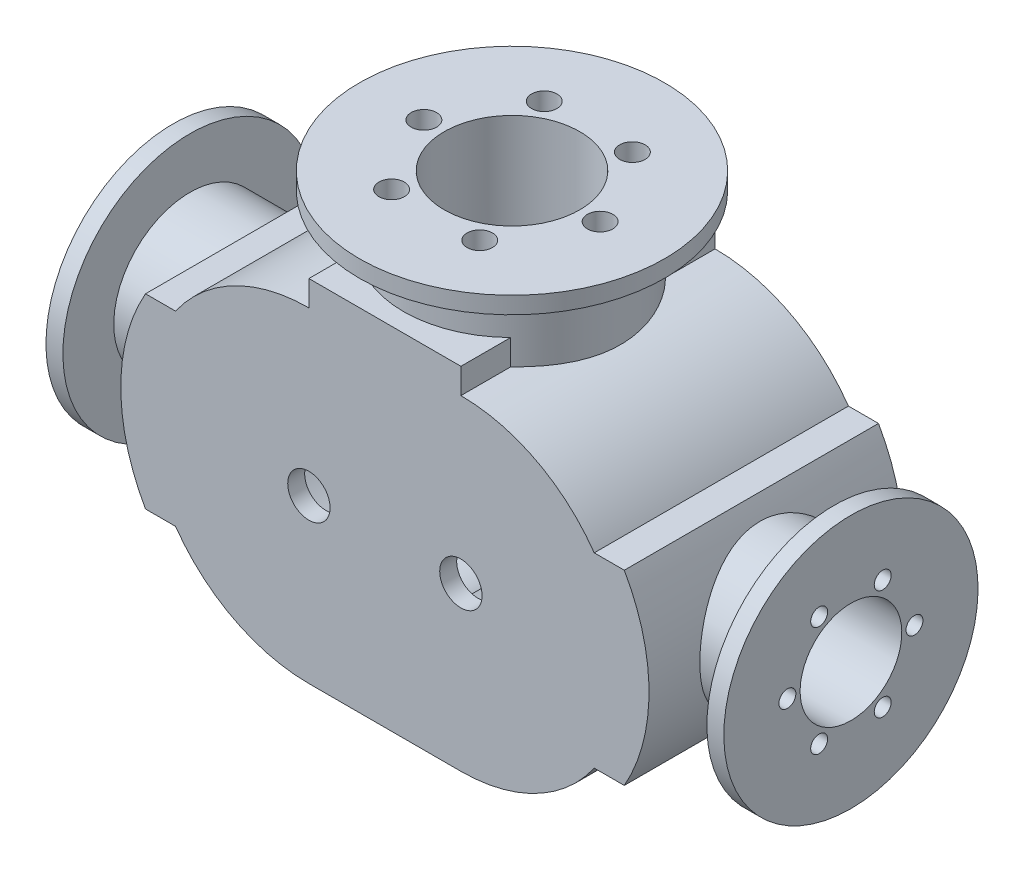
from build123d import *
from build123d.topology import SkipClean

# Parameters (mm, degrees)
BOSS_EXTRUDE1_DEPTH      = 150
CUT_EXTRUDE1_DEPTH       = 140
SKETCH5_R                = 12.5
CUT_EXTRUDE2_DEPTH       = 140
SKETCH6_W                = 89.69
SKETCH6_H                = 15
BOSS_EXTRUDE2_DEPTH      = 150
SKETCH20_R               = 5
CUT_EXTRUDE5_DEPTH       = 30
CRVPATTERN1_OUTLINE_R    = 5
CRVPATTERN1_DEPTH        = 30
BOSS_EXTRUDE3_START      = -16.9304
SKETCH22_R               = 64
SKETCH22_R_2             = 40
BOSS_EXTRUDE3_DEPTH      = 46.9304
CUT_EXTRUDE6_REACH       = 327.001
SKETCH27_R               = 90
SKETCH27_R_2             = 40
BOSS_EXTRUDE4_DEPTH      = 10
SKETCH29_R               = 7.5
CUT_EXTRUDE7_DEPTH       = 40
CIRPATTERN1_COUNT        = 6
BOSS_EXTRUDE5_REACH      = 422.299
BOSS_EXTRUDE5_END_RADIUS = 111
BOSS_EXTRUDE6_DEPTH      = 10
CUT_EXTRUDE8_DEPTH       = 421.299493249
SKETCH37_R               = 5
CUT_EXTRUDE9_DEPTH       = 30
CIRPATTERN2_COUNT        = 6
MIRROR2_COPY_1_SKETCH_R  = 5
MIRROR2_COPY_1_DEPTH     = 30
MIRROR2_COPY_2_SKETCH_R  = 5
MIRROR2_COPY_2_DEPTH     = 30
MIRROR2_COPY_3_SKETCH_R  = 5
MIRROR2_COPY_3_DEPTH     = 30
MIRROR2_COPY_4_SKETCH_R  = 5
MIRROR2_COPY_4_DEPTH     = 30
MIRROR2_COPY_5_SKETCH_R  = 5
MIRROR2_COPY_5_DEPTH     = 30


# Read off the part's stored shape, not the designer's step: CrvPattern1
with BuildPart() as part:
    # Sketch1 → Boss-Extrude1 (new body)
    with BuildSketch(Plane.XY):
        with BuildLine():
            Line((0, 96), (89.69, 96))
            ThreePointArc((89.69, 96), (185.69, 0), (89.69, -96))
            Line((89.69, -96), (0, -96))
            ThreePointArc((0, -96), (-96, 0), (0, 96))
        make_face()
    extrude(amount=BOSS_EXTRUDE1_DEPTH)

    # Sketch4 → Cut-Extrude1 (cut)
    with BuildSketch(Plane(origin=(0, 0, 0), x_dir=(-1, 0, 0), z_dir=(0, 0, -1))):
        with BuildLine():
            ThreePointArc((-44.845, 53.422733691), (-159.44, 0), (-44.845, -53.422733691))
            ThreePointArc((-44.845, -53.422733691), (69.75, 0), (-44.845, 53.422733691))
        make_face()
    extrude(amount=-CUT_EXTRUDE1_DEPTH, mode=Mode.SUBTRACT)

    # Sketch5 → Cut-Extrude2 (cut)
    with BuildSketch(Plane(origin=(0, 0, 140), x_dir=(-1, 0, 0), z_dir=(0, 0, -1))):
        with Locations((-89.69, 0)):
            Circle(SKETCH5_R)
        Circle(SKETCH5_R)
    extrude(amount=-CUT_EXTRUDE2_DEPTH, mode=Mode.SUBTRACT)

    # Sketch6 → Boss-Extrude2 (add, through all)
    with BuildSketch(Plane(origin=(0, 0, 0), x_dir=(-1, 0, 0), z_dir=(0, 0, -1))):
        with Locations((-44.845, 103.5)):
            Rectangle(SKETCH6_W, SKETCH6_H)
        with BuildLine():
            Line((-168.372907928, 55), (-186.105766346, 55))
            ThreePointArc((-186.105766346, 55), (-200.69, 0), (-186.105766346, -55))
            Line((-186.105766346, -55), (-168.372907928, -55))
            ThreePointArc((-168.372907928, -55), (-185.69, 0), (-168.372907928, 55))
        make_face()
        with BuildLine():
            ThreePointArc((96.415766346, -55), (111, 0), (96.415766346, 55))
            Line((96.415766346, 55), (78.682907928, 55))
            ThreePointArc((78.682907928, 55), (96, 0), (78.682907928, -55))
            Line((78.682907928, -55), (96.415766346, -55))
        make_face()
    extrude(amount=-BOSS_EXTRUDE2_DEPTH)

    # Sketch20 → Cut-Extrude5 (cut)
    with BuildSketch(Plane(origin=(0, 0, 0), x_dir=(-1, 0, 0), z_dir=(0, 0, -1))):
        with Locations((82.875, 0)):
            Circle(SKETCH20_R)
    extrude(amount=-CUT_EXTRUDE5_DEPTH, mode=Mode.SUBTRACT)

    # CrvPattern1 outline → CrvPattern1 (cut)
    with BuildSketch(Plane.XY):
        with Locations((-72.349610622, -40.420285352)):
            Circle(CRVPATTERN1_OUTLINE_R)
        with Locations((-72.349610622, 40.420285352)):
            Circle(CRVPATTERN1_OUTLINE_R)
        with Locations((-43.446958542, 70.573560335)):
            Circle(CRVPATTERN1_OUTLINE_R)
        with Locations((-3.508501794, 82.800700723)):
            Circle(CRVPATTERN1_OUTLINE_R)
        with Locations((44.845, 82.875)):
            Circle(CRVPATTERN1_OUTLINE_R)
        with Locations((93.198501794, 82.800700723)):
            Circle(CRVPATTERN1_OUTLINE_R)
        with Locations((133.136958542, 70.573560335)):
            Circle(CRVPATTERN1_OUTLINE_R)
        with Locations((162.039610622, 40.420285352)):
            Circle(CRVPATTERN1_OUTLINE_R)
        with Locations((172.565, 0)):
            Circle(CRVPATTERN1_OUTLINE_R)
        with Locations((162.039610622, -40.420285352)):
            Circle(CRVPATTERN1_OUTLINE_R)
        with Locations((133.136958542, -70.573560335)):
            Circle(CRVPATTERN1_OUTLINE_R)
        with Locations((93.198501794, -82.800700723)):
            Circle(CRVPATTERN1_OUTLINE_R)
        with Locations((44.845, -82.875)):
            Circle(CRVPATTERN1_OUTLINE_R)
        with Locations((-3.508501794, -82.800700723)):
            Circle(CRVPATTERN1_OUTLINE_R)
        with Locations((-43.446958542, -70.573560335)):
            Circle(CRVPATTERN1_OUTLINE_R)
    extrude(amount=CRVPATTERN1_DEPTH, mode=Mode.SUBTRACT)

    # Sketch22 → Boss-Extrude3 (add)
    with BuildSketch(Plane(origin=(0, 111, 0), x_dir=(1, 0, 0), z_dir=(0, 1, 0)).offset(BOSS_EXTRUDE3_START)):
        with Locations(Location((44.845, -75, 0), (0, 0, 134.483443073))):
            Circle(SKETCH22_R)
        with Locations(Location((44.845, -75, 0), (0, 0, 270))):
            Circle(SKETCH22_R_2, mode=Mode.SUBTRACT)
    extrude(amount=BOSS_EXTRUDE3_DEPTH)

    # Sketch22<3> → Cut-Extrude6 (cut, up to next)
    with BuildSketch(Plane(origin=(0, 111, 0), x_dir=(1, 0, 0), z_dir=(0, 1, 0)), mode=Mode.PRIVATE) as cut_extrude6_sk1:
        with BuildLine():
            ThreePointArc((65.372636787, -40.669020871), (10.514020871, -54.472363213), (24.317363213, -109.330979129))
            Line((24.317363213, -109.330979129), (65.372636787, -40.669020871))
        make_face()
    cut_extrude6_tool1 = extrude(cut_extrude6_sk1.sketch, amount=-CUT_EXTRUDE6_REACH, mode=Mode.PRIVATE) & part.part
    # Sketch22<3> → Cut-Extrude6 (cut, up to next)
    with BuildSketch(Plane(origin=(0, 111, 0), x_dir=(1, 0, 0), z_dir=(0, 1, 0)), mode=Mode.PRIVATE) as cut_extrude6_sk2:
        with BuildLine():
            Line((65.372636787, -40.669020871), (24.317363213, -109.330979129))
            ThreePointArc((24.317363213, -109.330979129), (64.579418265, -109.792998372), (84.845, -75))
            ThreePointArc((84.845, -75), (79.637998372, -55.265581735), (65.372636787, -40.669020871))
        make_face()
    cut_extrude6_tool2 = extrude(cut_extrude6_sk2.sketch, amount=-CUT_EXTRUDE6_REACH, mode=Mode.PRIVATE) & part.part
    # Sketch22<3> → Cut-Extrude6 (cut, up to next)
    with BuildSketch(Plane(origin=(0, 111, 0), x_dir=(1, 0, 0), z_dir=(0, 1, 0)), mode=Mode.PRIVATE) as cut_extrude6_sk3:
        with BuildLine():
            ThreePointArc((65.372636787, -40.669020871), (10.514020871, -54.472363213), (24.317363213, -109.330979129))
            Line((24.317363213, -109.330979129), (65.372636787, -40.669020871))
        make_face()
    cut_extrude6_tool3 = extrude(cut_extrude6_sk3.sketch, amount=-CUT_EXTRUDE6_REACH, mode=Mode.PRIVATE) & part.part
    # Sketch22<3> → Cut-Extrude6 (cut, up to next)
    with BuildSketch(Plane(origin=(0, 111, 0), x_dir=(1, 0, 0), z_dir=(0, 1, 0)), mode=Mode.PRIVATE) as cut_extrude6_sk4:
        with BuildLine():
            Line((65.372636787, -40.669020871), (24.317363213, -109.330979129))
            ThreePointArc((24.317363213, -109.330979129), (64.579418265, -109.792998372), (84.845, -75))
            ThreePointArc((84.845, -75), (79.637998372, -55.265581735), (65.372636787, -40.669020871))
        make_face()
    cut_extrude6_tool4 = extrude(cut_extrude6_sk4.sketch, amount=-CUT_EXTRUDE6_REACH, mode=Mode.PRIVATE) & part.part
    add(cut_extrude6_tool1.solids().sort_by_distance((30.27448, 111, 66.2878))[0], mode=Mode.SUBTRACT)
    add(cut_extrude6_tool2.solids().sort_by_distance((59.41552, 111, 83.7122))[0], mode=Mode.SUBTRACT)
    add(cut_extrude6_tool3.solids().sort_by_distance((30.27448, 111, 66.2878))[0], mode=Mode.SUBTRACT)
    add(cut_extrude6_tool4.solids().sort_by_distance((59.41552, 111, 83.7122))[0], mode=Mode.SUBTRACT)

    # Sketch27 → Boss-Extrude4 (add)
    with SkipClean():  # the faces are left unmerged after this step: merging them gives an invalid solid
        with BuildSketch(Plane(origin=(0, 141, 0), x_dir=(1, 0, 0), z_dir=(0, 1, 0))):
            with Locations(Location((44.845, -75, 0), (0, 0, 270))):
                Circle(SKETCH27_R)
            with Locations(Location((44.845, -75, 0), (0, 0, 270))):
                Circle(SKETCH27_R_2, mode=Mode.SUBTRACT)
        extrude(amount=BOSS_EXTRUDE4_DEPTH)

    # Sketch29 → Cut-Extrude7 (cut)
    with SkipClean():  # the faces are left unmerged after this step: merging them gives an invalid solid
        with BuildSketch(Plane(origin=(0, 151, 0), x_dir=(1, 0, 0), z_dir=(0, 1, 0))):
            with Locations(Location((96.845, -75, 0), (0, 0, 270))):
                Circle(SKETCH29_R)
        cut_extrude7 = extrude(amount=-CUT_EXTRUDE7_DEPTH, mode=Mode.SUBTRACT)

    # CirPattern1: Cut-Extrude7 ×6 about axis
    with SkipClean():  # the faces are left unmerged after this step: merging them gives an invalid solid
        cirpattern1_axis = Axis((44.845, 0, 75), (0, 1, 0))
        for i in range(1, CIRPATTERN1_COUNT):
            add(cut_extrude7.rotate(cirpattern1_axis, i * 360 / CIRPATTERN1_COUNT), mode=Mode.SUBTRACT)

    # Boss-Extrude5: up to this cylinder (the profile starts outside it)
    with SkipClean():  # the faces are left unmerged after this step: merging them gives an invalid solid
        boss_extrude5_end = Plane(origin=(0, 0, 75), z_dir=(0, 0, -1)) * Cylinder(BOSS_EXTRUDE5_END_RADIUS, 1142.598, mode=Mode.PRIVATE)
        # Sketch34 → Boss-Extrude5 (add, up to the surface)
        with BuildSketch(Plane.ZY.offset(155.155), mode=Mode.PRIVATE) as boss_extrude5_sk1:
            with BuildLine():
                ThreePointArc((45, 0), (75, 30), (105, 0))
                Line((105, 0), (120, 0))
                ThreePointArc((120, 0), (75, 45), (30, 0))
                Line((30, 0), (45, 0))
            make_face()
        boss_extrude5_tool1 = extrude(boss_extrude5_sk1.sketch, amount=-BOSS_EXTRUDE5_REACH, mode=Mode.PRIVATE) - boss_extrude5_end
        # Sketch34 → Boss-Extrude5 (add, up to the surface)
        with BuildSketch(Plane.ZY.offset(155.155), mode=Mode.PRIVATE) as boss_extrude5_sk2:
            with BuildLine():
                Line((120, 0), (105, 0))
                ThreePointArc((105, 0), (75, -30), (45, 0))
                Line((45, 0), (30, 0))
                ThreePointArc((30, 0), (75, -45), (120, 0))
            make_face()
        boss_extrude5_tool2 = extrude(boss_extrude5_sk2.sketch, amount=-BOSS_EXTRUDE5_REACH, mode=Mode.PRIVATE) - boss_extrude5_end
        # Sketch34 → Boss-Extrude5 (add, up to the surface)
        with BuildSketch(Plane.ZY.offset(155.155), mode=Mode.PRIVATE) as boss_extrude5_sk3:
            with BuildLine():
                ThreePointArc((45, 0), (75, 30), (105, 0))
                Line((105, 0), (120, 0))
                ThreePointArc((120, 0), (75, 45), (30, 0))
                Line((30, 0), (45, 0))
            make_face()
        boss_extrude5_tool3 = extrude(boss_extrude5_sk3.sketch, amount=-BOSS_EXTRUDE5_REACH, mode=Mode.PRIVATE) - boss_extrude5_end
        # Sketch34 → Boss-Extrude5 (add, up to the surface)
        with BuildSketch(Plane.ZY.offset(155.155), mode=Mode.PRIVATE) as boss_extrude5_sk4:
            with BuildLine():
                Line((120, 0), (105, 0))
                ThreePointArc((105, 0), (75, -30), (45, 0))
                Line((45, 0), (30, 0))
                ThreePointArc((30, 0), (75, -45), (120, 0))
            make_face()
        boss_extrude5_tool4 = extrude(boss_extrude5_sk4.sketch, amount=-BOSS_EXTRUDE5_REACH, mode=Mode.PRIVATE) - boss_extrude5_end
        boss_extrude5 = boss_extrude5_tool1.solids().sort_by_distance((-155.155, 1.006231, 37.5))[0] + boss_extrude5_tool2.solids().sort_by_distance((-155.155, -1.006231, 112.5))[0] + boss_extrude5_tool3.solids().sort_by_distance((-155.155, 1.006231, 37.5))[0] + boss_extrude5_tool4.solids().sort_by_distance((-155.155, -1.006231, 112.5))[0]
        add(boss_extrude5)

    # Sketch34<3> → Boss-Extrude6 (add)
    with SkipClean():  # the faces are left unmerged after this step: merging them gives an invalid solid
        with BuildSketch(Plane.ZY.offset(155.155)):
            with BuildLine():
                ThreePointArc((30, 0), (75, 45), (120, 0))
                Line((120, 0), (150, 0))
                ThreePointArc((150, 0), (75, 75), (0, 0))
                Line((0, 0), (30, 0))
            make_face()
            with BuildLine():
                Line((150, 0), (120, 0))
                ThreePointArc((120, 0), (75, -45), (30, 0))
                Line((30, 0), (0, 0))
                ThreePointArc((0, 0), (75, -75), (150, 0))
            make_face()
        boss_extrude6 = extrude(amount=-BOSS_EXTRUDE6_DEPTH)

    # Sketch34<5> → Cut-Extrude8 (cut, through all)
    with SkipClean():  # the faces are left unmerged after this step: merging them gives an invalid solid
        with BuildSketch(Plane.ZY.offset(155.155)):
            with BuildLine():
                ThreePointArc((45, 0), (75, -30), (105, 0))
                Line((105, 0), (45, 0))
            make_face()
            with BuildLine():
                Line((45, 0), (105, 0))
                ThreePointArc((105, 0), (75, 30), (45, 0))
            make_face()
        extrude(amount=-CUT_EXTRUDE8_DEPTH, mode=Mode.SUBTRACT)

    # Sketch37 → Cut-Extrude9 (cut)
    with SkipClean():  # the faces are left unmerged after this step: merging them gives an invalid solid
        with BuildSketch(Plane.ZY.offset(155.155)):
            with Locations(Location((112.5, 0, 0), (0, 0, 270))):
                Circle(SKETCH37_R)
        cut_extrude9 = extrude(amount=-CUT_EXTRUDE9_DEPTH, mode=Mode.SUBTRACT)

    # CirPattern2: Cut-Extrude9 ×6 about axis
    with SkipClean():  # the faces are left unmerged after this step: merging them gives an invalid solid
        cirpattern2_axis = Axis((0, 0, 75), (1, 0, 0))
        for i in range(1, CIRPATTERN2_COUNT):
            add(cut_extrude9.rotate(cirpattern2_axis, i * 360 / CIRPATTERN2_COUNT), mode=Mode.SUBTRACT)

    # Mirror2: Boss-Extrude5, Boss-Extrude6, Cut-Extrude9 across plane
    with SkipClean():  # the faces are left unmerged after this step: merging them gives an invalid solid
        add(boss_extrude5.mirror(Plane.ZY.offset(-44.845)))
        add(boss_extrude6.mirror(Plane.ZY.offset(-44.845)))
        add(cut_extrude9.mirror(Plane.ZY.offset(-44.845)), mode=Mode.SUBTRACT)

    # Mirror2 copy 1 sketch → Mirror2 copy 1 (cut)
    with SkipClean():  # the faces are left unmerged after this step: merging them gives an invalid solid
        with BuildSketch(Plane(origin=(244.845, 64.951905284, 37.5), x_dir=(-2.277608259478311e-14, -0.8660254037844386, 0.5000000000000001), z_dir=(1, 0, 0))):
            with Locations((112.5, 0)):
                Circle(MIRROR2_COPY_1_SKETCH_R)
        extrude(amount=-MIRROR2_COPY_1_DEPTH, mode=Mode.SUBTRACT)

    # Mirror2 copy 2 sketch → Mirror2 copy 2 (cut)
    with SkipClean():  # the faces are left unmerged after this step: merging them gives an invalid solid
        with BuildSketch(Plane(origin=(244.845, 64.951905284, 112.5), x_dir=(-2.277608259478311e-14, -0.8660254037844387, -0.4999999999999998), z_dir=(1, 0, 0))):
            with Locations((112.5, 0)):
                Circle(MIRROR2_COPY_2_SKETCH_R)
        extrude(amount=-MIRROR2_COPY_2_DEPTH, mode=Mode.SUBTRACT)

    # Mirror2 copy 3 sketch → Mirror2 copy 3 (cut)
    with SkipClean():  # the faces are left unmerged after this step: merging them gives an invalid solid
        with BuildSketch(Plane(origin=(244.845, 0, 150), x_dir=(0, 0, -1), z_dir=(1, 0, 0))):
            with Locations((112.5, 0)):
                Circle(MIRROR2_COPY_3_SKETCH_R)
        extrude(amount=-MIRROR2_COPY_3_DEPTH, mode=Mode.SUBTRACT)

    # Mirror2 copy 4 sketch → Mirror2 copy 4 (cut)
    with SkipClean():  # the faces are left unmerged after this step: merging them gives an invalid solid
        with BuildSketch(Plane(origin=(244.845, -64.951905284, 112.5), x_dir=(2.2776082594783096e-14, 0.8660254037844384, -0.5000000000000004), z_dir=(1, 0, 0))):
            with Locations((112.5, 0)):
                Circle(MIRROR2_COPY_4_SKETCH_R)
        extrude(amount=-MIRROR2_COPY_4_DEPTH, mode=Mode.SUBTRACT)

    # Mirror2 copy 5 sketch → Mirror2 copy 5 (cut)
    with SkipClean():  # the faces are left unmerged after this step: merging them gives an invalid solid
        with BuildSketch(Plane(origin=(244.845, -64.951905284, 37.5), x_dir=(2.2776082594783102e-14, 0.8660254037844386, 0.5000000000000001), z_dir=(1, 0, 0))):
            with Locations((112.5, 0)):
                Circle(MIRROR2_COPY_5_SKETCH_R)
        extrude(amount=-MIRROR2_COPY_5_DEPTH, mode=Mode.SUBTRACT)


solid = part.part
